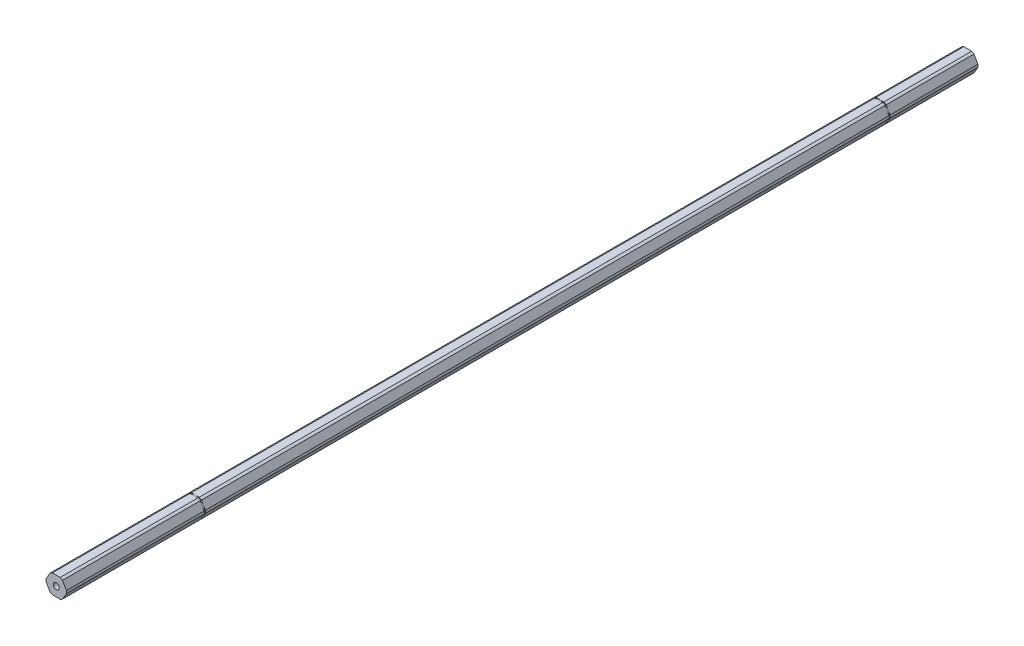
from build123d import *

# Parameters (mm, degrees)
SKETCH1_R           = 2.000000064
BOSS_EXTRUDE1_DEPTH = 609.6
SKETCH2_W           = 1.651
SKETCH2_H           = 0.889


with BuildPart() as part:
    # Sketch1 → Boss-Extrude1 (new body)
    with BuildSketch(Plane.XY):
        with BuildLine():
            ThreePointArc((4.181770846, 5.456960429), (3.437499983, 5.953924622), (2.634980936, 6.35))
            Line((2.634980936, 6.35), (-2.634980936, 6.35))
            ThreePointArc((-2.634980936, 6.35), (-3.437499983, 5.953924622), (-4.181770846, 5.456960429))
            Line((-4.181770846, 5.456960429), (-6.816751782, 0.893039571))
            ThreePointArc((-6.816751782, 0.893039571), (-6.874999966, 0), (-6.816751782, -0.893039571))
            Line((-6.816751782, -0.893039571), (-4.181770846, -5.456960429))
            ThreePointArc((-4.181770846, -5.456960429), (-3.437499983, -5.953924622), (-2.634980936, -6.35))
            Line((-2.634980936, -6.35), (2.634980936, -6.35))
            ThreePointArc((2.634980936, -6.35), (3.437499983, -5.953924622), (4.181770846, -5.456960429))
            Line((4.181770846, -5.456960429), (6.816751782, -0.893039571))
            ThreePointArc((6.816751782, -0.893039571), (6.860422465, -0.447468582), (6.874999966, 0))
            ThreePointArc((6.874999966, 0), (6.860422465, 0.447468582), (6.816751782, 0.893039571))
            Line((6.816751782, 0.893039571), (4.181770846, 5.456960429))
        make_face()
        Circle(SKETCH1_R, mode=Mode.SUBTRACT)
    extrude(amount=BOSS_EXTRUDE1_DEPTH)

    # Sketch2 → Cut-Revolve1 (revolve, cut)
    with BuildSketch(Plane(origin=(0, 0, 0), x_dir=(1, 0, 0), z_dir=(0, 1, 0))):
        with Locations((7.1755, -517.0805)):
            Rectangle(SKETCH2_W, SKETCH2_H)
        with Locations((7.1755, -59.182)):
            Rectangle(SKETCH2_W, SKETCH2_H)
    revolve(axis=Axis((0, 0, 609.6), (0, 0, -1)), mode=Mode.SUBTRACT)


solid = part.part
